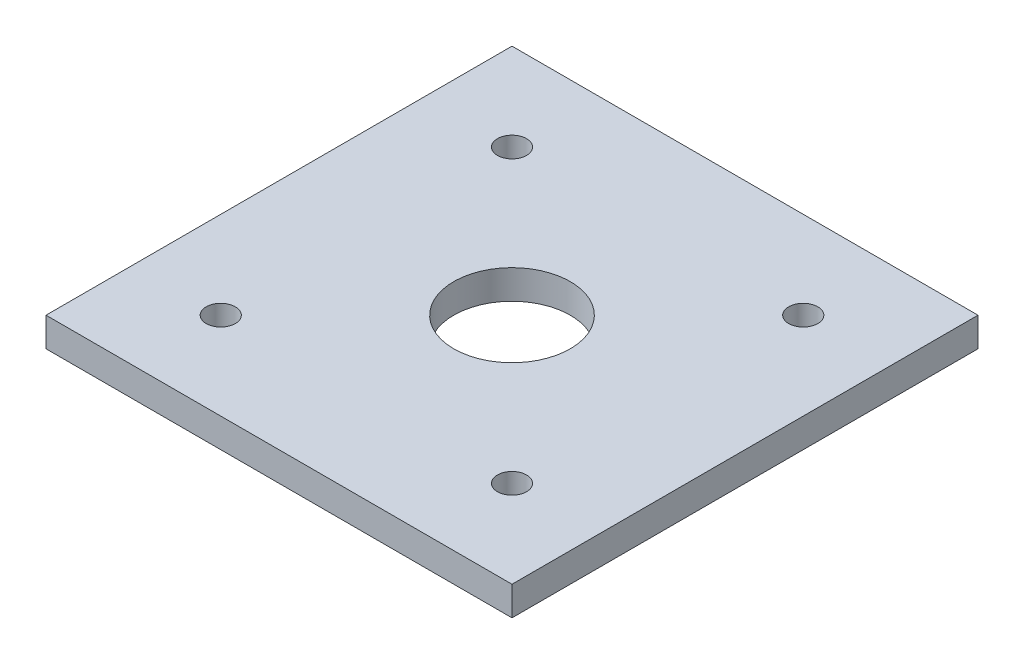
from build123d import *

# Parameters (mm, degrees)
SKETCH1_W                   = 101.6
SKETCH1_H                   = 101.6
SKETCH1_R                   = 12.7
BOSS_EXTRUDE1_DEPTH         = 6.35
F_1_4_0_25_DIAMETER_HOLE1_D = 6.35
CIRPATTERN1_COUNT           = 4


with BuildPart() as part:
    # Sketch1 → Boss-Extrude1 (new body)
    with BuildSketch(Plane(origin=(0, 0, 0), x_dir=(1, 0, 0), z_dir=(0, 1, 0))):
        Rectangle(SKETCH1_W, SKETCH1_H)
        Circle(SKETCH1_R, mode=Mode.SUBTRACT)
    extrude(amount=BOSS_EXTRUDE1_DEPTH)

    # 1/4 (0.25) Diameter Hole1 (through all)
    with Locations(Plane(origin=(0, 6.35, 0), x_dir=(1, 0, 0), z_dir=(0, 1, 0))):
        with Locations((-31.75, -31.75)):
            f_1_4_0_25_diameter_hole1 = Hole(F_1_4_0_25_DIAMETER_HOLE1_D / 2)

    # CirPattern1: 1/4 (0.25) Diameter Hole1 ×4 about axis
    cirpattern1_axis = Axis((0, 6.35, 0), (0, -1, 0))
    for i in range(1, CIRPATTERN1_COUNT):
        add(f_1_4_0_25_diameter_hole1.rotate(cirpattern1_axis, i * 360 / CIRPATTERN1_COUNT), mode=Mode.SUBTRACT)


solid = part.part
